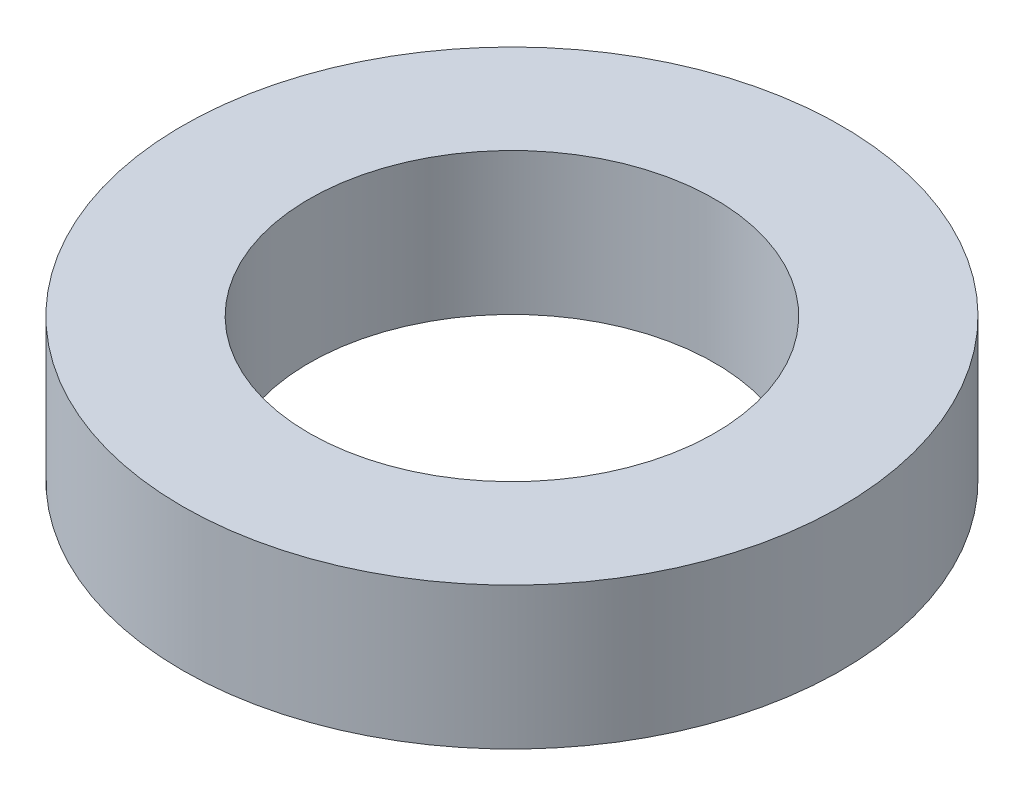
from build123d import *

# Parameters (mm, degrees)
SKETCH1_R           = 65
BOSS_EXTRUDE1_DEPTH = 28
SKETCH2_R           = 40
CUT_EXTRUDE1_DEPTH  = 97.093704268


with BuildPart() as part:
    # Sketch1 → Boss-Extrude1 (new body)
    with BuildSketch(Plane(origin=(0, 0, 0), x_dir=(1, 0, 0), z_dir=(0, 1, 0))):
        Circle(SKETCH1_R)
    extrude(amount=BOSS_EXTRUDE1_DEPTH)

    # Sketch2 → Cut-Extrude1 (cut, through all)
    with BuildSketch(Plane(origin=(0, 0, 0), x_dir=(1, 0, 0), z_dir=(0, 1, 0))):
        Circle(SKETCH2_R)
    extrude(amount=CUT_EXTRUDE1_DEPTH, mode=Mode.SUBTRACT)


solid = part.part
